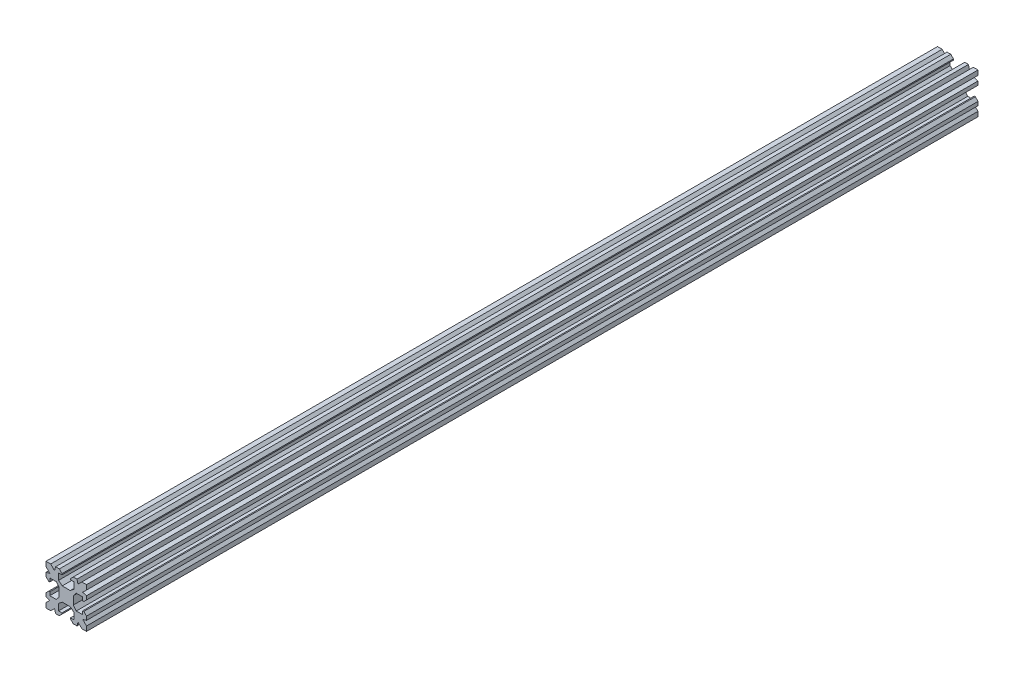
from build123d import *

# Parameters (mm, degrees)
EXTRUDE_1_DEPTH     = 330
CUT_EXTRUDE_1_DEPTH = 331.170410546
CHAMFER_1_SIZE      = 1


with BuildPart() as part:
    # Эскиз1 → Бобышка-Вытянуть1 (new body)
    with BuildSketch(Plane.XY):
        Polygon((1.58, 7.5), (1.58, 6.1), (2.85, 6.1), (2.85, 3.7), (-2.85, 3.7), (-2.85, 6.1), (-1.58, 6.1), (-1.58, 7.5), (-3.962017091, 7.5), (-4.342017091, 6.08), (-5.762017091, 7.5), (-7.5, 7.5), (-7.5, 5.762017091), (-6.08, 4.342017091), (-7.5, 3.962017091), (-7.5, 1.58), (-6.1, 1.58), (-6.1, 2.85), (-3.7, 2.85), (-3.7, -2.85), (-6.1, -2.85), (-6.1, -1.58), (-7.5, -1.58), (-7.5, -3.962017091), (-6.08, -4.342017091), (-7.5, -5.762017091), (-7.5, -7.5), (-5.762017091, -7.5), (-4.342017091, -6.08), (-3.962017091, -7.5), (-1.58, -7.5), (-1.58, -6.1), (-2.85, -6.1), (-2.85, -3.7), (2.85, -3.7), (2.85, -6.1), (1.58, -6.1), (1.58, -7.5), (3.962017091, -7.5), (4.342017091, -6.08), (5.762017091, -7.5), (7.5, -7.5), (7.5, -5.762017091), (6.08, -4.342017091), (7.5, -3.962017091), (7.5, -1.58), (6.1, -1.58), (6.1, -2.85), (3.7, -2.85), (3.7, 2.85), (6.1, 2.85), (6.1, 1.58), (7.5, 1.58), (7.5, 3.962017091), (6.08, 4.342017091), (7.5, 5.762017091), (7.5, 7.5), (5.762017091, 7.5), (4.342017091, 6.08), (3.962017091, 7.5), align=None)
    extrude(amount=EXTRUDE_1_DEPTH)

    # Эскиз2 → Вырез-Вытянуть1 (cut, through all)
    with BuildSketch(Plane.XY.offset(330)):
        Polygon((-3.7, 2.85), (-2.6, 1.5), (-2.6, -1.5), (-3.7, -2.85), align=None)
        Polygon((2.85, 3.7), (1.5, 2.6), (-1.5, 2.6), (-2.85, 3.7), align=None)
        Polygon((3.7, -2.85), (2.6, -1.5), (2.6, 1.5), (3.7, 2.85), align=None)
        Polygon((-2.85, -3.7), (-1.5, -2.6), (1.5, -2.6), (2.85, -3.7), align=None)
    extrude(amount=-CUT_EXTRUDE_1_DEPTH, mode=Mode.SUBTRACT)

    # Фаска1
    chamfer_1_edges = [part.edges().sort_by_distance(p)[0] for p in [
        (-7.5, 1.58, 165),
        (-7.5, -1.58, 165),
        (1.58, -7.5, 165),
        (-1.58, -7.5, 165),
        (7.5, -1.58, 165),
        (7.5, 1.58, 165),
        (1.58, 7.5, 165),
        (-1.58, 7.5, 165),
    ]]
    chamfer(chamfer_1_edges, length=CHAMFER_1_SIZE)


solid = part.part
